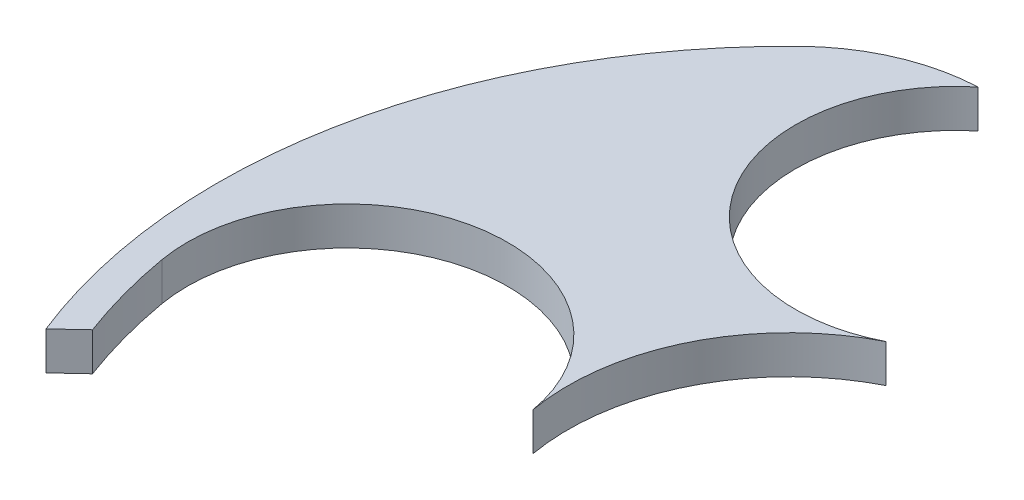
from build123d import *

# Parameters (mm, degrees)
BOSS_EXTRU_1_DEPTH = 5


with BuildPart() as part:
    # Esquisse1 → Boss.-Extru.1 (new body)
    with BuildSketch(Plane(origin=(0, 0, 0), x_dir=(1, 0, 0), z_dir=(0, 1, 0))):
        with BuildLine():
            ThreePointArc((-68.670306383, 42.279177512), (-89.686678349, 4.155942482), (-85.987250464, -39.218971617))
            Line((-85.987250464, -39.218971617), (-82.83716136, -36.273074377))
            ThreePointArc((-82.83716136, -36.273074377), (-84.826823628, -30.09859374), (-86.244619049, -23.768283856))
            ThreePointArc((-86.244619049, -23.768283856), (-69.212709026, 0.560999754), (-44.883425416, -16.470910269))
            ThreePointArc((-44.883425416, -16.470910269), (-42.279203381, 1.504277637), (-29.4940321, 14.405004281))
            ThreePointArc((-29.4940321, 14.405004281), (-56.605124577, 21.619714422), (-52.350511604, 49.349872124))
            ThreePointArc((-52.350511604, 49.349872124), (-61.160452612, 47.314883556), (-68.670306383, 42.279177512))
        make_face()
    extrude(amount=BOSS_EXTRU_1_DEPTH)


solid = part.part
